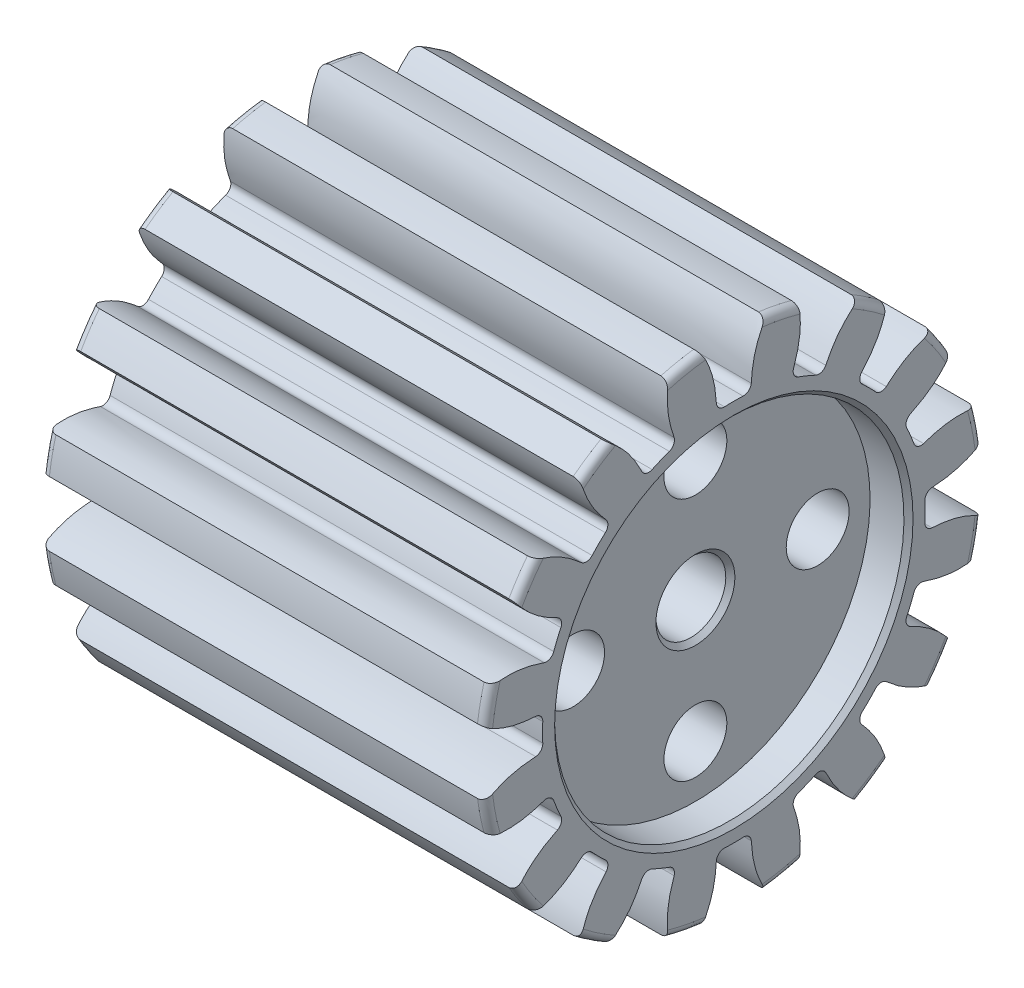
from build123d import *

# Parameters (mm, degrees)
SKETCH12_W                     = 25.4
SKETCH12_H                     = 12.351
FILLET1_R                      = 0.4445
FILLET2_R                      = 0.445641616
CIRPATTERN4_COUNT              = 16
FILLET2_OF_CIRPATTERN4_R       = 0.445641616
SKETCH13_R                     = 10
CUT_EXTRUDE1_DEPTH             = 2.2
CHAMFER1_SIZE                  = 0.26
CBORE_FOR_M3_SHCS1_D           = 3.6
CBORE_FOR_M3_SHCS1_CBORE_D     = 6.5
CBORE_FOR_M3_SHCS1_CBORE_DEPTH = 13.16


with BuildPart() as part:
    # Sketch12 → Revolve3 (revolve)
    with BuildSketch(Plane.XY):
        with Locations((-12.7, 8.1755)):
            Rectangle(SKETCH12_W, SKETCH12_H)
    revolve(axis=Axis((0, 0, 0), (1, 0, 0)))

    # Fillet1
    fillet1_edges = [part.edges().sort_by_distance(p)[0] for p in [
        (-25.4, -14.351, 0),
        (0, -14.351, 0),
    ]]
    fillet(fillet1_edges, radius=FILLET1_R)

    # Cut-Sweep1: sweep along a path in Sketch7
    with BuildLine(Plane.XY) as cut_sweep1_path:
        Line((-25.4, 0), (11.9126, 0))
    # Sketch6 → Cut-Sweep1 (sweep, cut)
    with BuildSketch(Plane(origin=(-25.4, 0, 0), x_dir=(0, 0, -1), z_dir=(-1, 0, 0))):
        with BuildLine():
            Line((-10.90885768, -0.960680225), (-11.779948032, -1.037392132))
            ThreePointArc((-11.779948032, -1.037392132), (-13.053142055, -1.301242785), (-14.231003868, -1.851952997))
            ThreePointArc((-14.231003868, -1.851952997), (-14.351, 0), (-14.231003868, 1.851952997))
            ThreePointArc((-14.231003868, 1.851952997), (-13.053142055, 1.301242785), (-11.779948032, 1.037392132))
            Line((-11.779948032, 1.037392132), (-10.90885768, 0.960680225))
            ThreePointArc((-10.90885768, 0.960680225), (-10.951076768, 0), (-10.90885768, -0.960680225))
        make_face()
    cut_sweep1 = sweep(path=cut_sweep1_path.line, mode=Mode.SUBTRACT)

    # Fillet2
    fillet2_edges = [part.edges().sort_by_distance(p)[0] for p in [
        (-12.7, -0.960680225, 10.90885768),
        (-12.7, 0.960680225, 10.90885768),
    ]]
    fillet(fillet2_edges, radius=FILLET2_R)

    # CirPattern4: Cut-Sweep1 ×16 about axis
    cirpattern4_axis = Axis((-25.4, 0, 0), (1, 0, 0))
    for i in range(1, CIRPATTERN4_COUNT):
        add(cut_sweep1.rotate(cirpattern4_axis, i * 360 / CIRPATTERN4_COUNT), mode=Mode.SUBTRACT)

    # Fillet2 of CirPattern4
    fillet2_of_cirpattern4_edges = [part.edges().sort_by_distance(p)[0] for p in [
        (-12.7, -5.062191897, 9.710833927),
        (-12.7, -3.287086303, 10.446106739),
        (-12.7, -8.393030742, 7.034423739),
        (-12.7, -7.034423739, 8.393030742),
        (-12.7, -10.446106739, 3.287086303),
        (-12.7, -9.710833927, 5.062191897),
        (-12.7, -10.90885768, -0.960680225),
        (-12.7, -10.90885768, 0.960680225),
        (-12.7, -9.710833927, -5.062191897),
        (-12.7, -10.446106739, -3.287086303),
        (-12.7, -7.034423739, -8.393030742),
        (-12.7, -8.393030742, -7.034423739),
        (-12.7, -3.287086303, -10.446106739),
        (-12.7, -5.062191897, -9.710833927),
        (-12.7, 0.960680225, -10.90885768),
        (-12.7, -0.960680225, -10.90885768),
        (-12.7, 5.062191897, -9.710833927),
        (-12.7, 3.287086303, -10.446106739),
        (-12.7, 8.393030742, -7.034423739),
        (-12.7, 7.034423739, -8.393030742),
        (-12.7, 10.446106739, -3.287086303),
        (-12.7, 9.710833927, -5.062191897),
        (-12.7, 10.90885768, 0.960680225),
        (-12.7, 10.90885768, -0.960680225),
        (-12.7, 9.710833927, 5.062191897),
        (-12.7, 10.446106739, 3.287086303),
        (-12.7, 7.034423739, 8.393030742),
        (-12.7, 8.393030742, 7.034423739),
        (-12.7, 3.287086303, 10.446106739),
        (-12.7, 5.062191897, 9.710833927),
    ]]
    fillet(fillet2_of_cirpattern4_edges, radius=FILLET2_OF_CIRPATTERN4_R)

    # Sketch13 → Cut-Extrude1 (cut)
    with BuildSketch(Plane(origin=(0, 0, 0), x_dir=(0, 0, -1), z_dir=(1, 0, 0))):
        Circle(SKETCH13_R)
    extrude(amount=-CUT_EXTRUDE1_DEPTH, mode=Mode.SUBTRACT)

    # Chamfer1
    chamfer1_edges = [part.edges().sort_by_distance(p)[0] for p in [
        (-25.4, -2, 0),
        (0, 0, 10),
        (-2.2, -2, 0),
    ]]
    chamfer(chamfer1_edges, length=CHAMFER1_SIZE)

    # CBORE for M3 SHCS1 (through all)
    with Locations(Plane.ZY.offset(25.4)):
        with Locations((0, 7), (7, 0), (0, -7), (-7, 0)):
            CounterBoreHole(CBORE_FOR_M3_SHCS1_D / 2, CBORE_FOR_M3_SHCS1_CBORE_D / 2, CBORE_FOR_M3_SHCS1_CBORE_DEPTH)


solid = part.part
